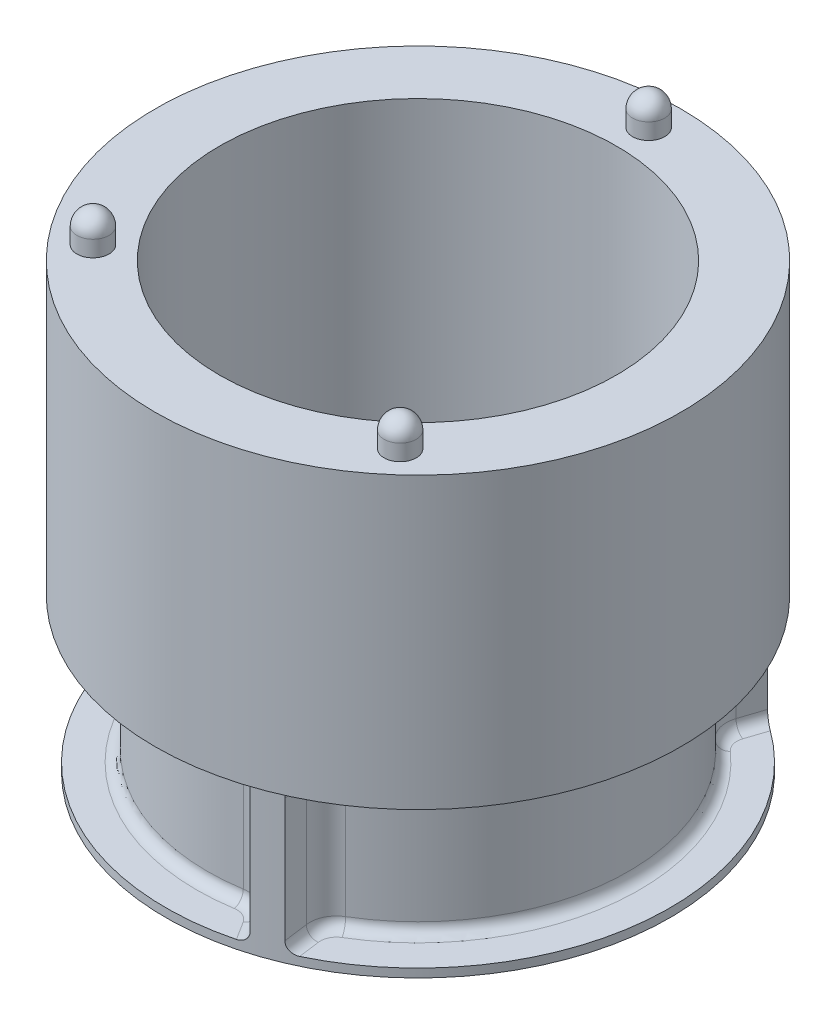
from build123d import *

# Parameters (mm, degrees)
SKETCH1_R            = 24.5
SKETCH1_R_2          = 18.5
BOSS_EXTRUDE1_DEPTH  = 27
SKETCH2_R            = 19.625
SKETCH2_R_2          = 18.125
BOSS_EXTRUDE2_DEPTH  = 13.5
SKETCH4_R            = 23.5
SKETCH4_R_2          = 18.125
BOSS_EXTRUDE3_DEPTH  = 0.8
SKETCH3_R            = 1.5
BOSS_EXTRUDE4_DEPTH  = 3
FILLET1_R            = 1.5
BOSS_EXTRUDE14_DEPTH = 13.5
FILLET3_R            = 2.5
FILLET4_R            = 1


with BuildPart() as part:
    # Sketch1 → Boss-Extrude1 (new body)
    with BuildSketch(Plane(origin=(0, 0, 0), x_dir=(1, 0, 0), z_dir=(0, 1, 0))):
        with Locations(Location((0, 0, 0), (0, 0, 270))):
            Circle(SKETCH1_R)
        with Locations(Location((0, 0, 0), (0, 0, 270))):
            Circle(SKETCH1_R_2, mode=Mode.SUBTRACT)
    extrude(amount=-BOSS_EXTRUDE1_DEPTH)

    # Sketch2 → Boss-Extrude2 (add)
    with BuildSketch(Plane.XZ.offset(27)):
        with Locations(Location((0, 0, 0), (0, 0, 90))):
            Circle(SKETCH2_R)
        with Locations(Location((0, 0, 0), (0, 0, 270))):
            Circle(SKETCH2_R_2, mode=Mode.SUBTRACT)
    extrude(amount=BOSS_EXTRUDE2_DEPTH)

    # Sketch4 → Boss-Extrude3 (add)
    with BuildSketch(Plane.XZ.offset(40.5)):
        with Locations(Location((0, 0, 0), (0, 0, 270))):
            Circle(SKETCH4_R)
        with Locations(Location((0, 0, 0), (0, 0, 270))):
            Circle(SKETCH4_R_2, mode=Mode.SUBTRACT)
    extrude(amount=BOSS_EXTRUDE3_DEPTH)

    # Sketch3 → Boss-Extrude4 (add)
    with BuildSketch(Plane(origin=(0, 0, 0), x_dir=(1, 0, 0), z_dir=(0, 1, 0))):
        with Locations(Location((0, 21.5, 0), (0, 0, 270))):
            Circle(SKETCH3_R)
        with Locations(Location((-16.426644714, -13.871815665, 0), (0, 0, 270))):
            Circle(SKETCH3_R)
        with Locations(Location((14.349874969, -16.010343168, 0), (0, 0, 270))):
            Circle(SKETCH3_R)
    extrude(amount=BOSS_EXTRUDE4_DEPTH)

    # Fillet1
    fillet1_edges = [part.edges().sort_by_distance(p)[0] for p in [
        (0, 3, -23),
        (-16.426644714, 3, 12.371815665),
        (14.349874969, 3, 14.510343168),
    ]]
    fillet(fillet1_edges, radius=FILLET1_R)

    # Sketch6 → Boss-Extrude14 (add)
    with BuildSketch(Plane.XZ.offset(27)):
        with BuildLine():
            Line((10.427001294, -21.060096012), (6.880284611, -17.172992857))
            ThreePointArc((6.880284611, -17.172992857), (9.221324303, -16.03799171), (11.379993428, -14.585806443))
            Line((11.379993428, -14.585806443), (13.025077505, -19.560096012))
            ThreePointArc((13.025077505, -19.560096012), (11.75, -20.351596989), (10.427001294, -21.060096012))
        make_face()
        with BuildLine():
            Line((9.20904846, 21.620440015), (8.507694451, 16.427694151))
            ThreePointArc((8.507694451, 16.427694151), (6.327372652, 17.384313485), (4.042246199, 18.052984398))
            Line((4.042246199, 18.052984398), (6.842810559, 22.481680179))
            ThreePointArc((6.842810559, 22.481680179), (8.037473368, 22.082776588), (9.20904846, 21.620440015))
        make_face()
    extrude(amount=BOSS_EXTRUDE14_DEPTH)

    # Fillet3
    fillet3_edges = [part.edges().sort_by_distance(p)[0] for p in [
        (8.667040078, -33.75, 17.607471178),
        (4.678526421, -33.75, 19.059171428),
        (11.753741984, -33.75, -15.715921048),
        (7.686830622, -33.75, -18.056944924),
    ]]
    fillet(fillet3_edges, radius=FILLET3_R)

    # Fillet4
    # the kernel refuses this fillet: 1 mm, written as the material it adds along each edge
    with BuildSketch(Plane(origin=(5.597678623, -27, 20.512680419), x_dir=(-0.845187772005224, 0, 0.5344694846788222), z_dir=(0.5344694846788222, 0, 0.845187772005224))) as fillet4_piece_1_section:
        with BuildLine():
            CenterArc((FILLET4_R, FILLET4_R), FILLET4_R, 180, 90)
            Line((0, FILLET4_R), (0, 0))
            Line((0, 0), (FILLET4_R, 0))
        make_face()
    fillet4_piece_1 = extrude(amount=4.829659544, mode=Mode.PRIVATE)
    fillet4_piece_1 = fillet4_piece_1 & Plane(origin=(0, -27.229900113, 0), x_dir=(0.29118342802716585, 0, 0.9566672416479768), z_dir=(0, 1, 0)) * Cylinder(23.5, 14, mode=Mode.PRIVATE)
    add(fillet4_piece_1)
    with BuildSketch(Plane(origin=(5.597678623, -40.5, 20.512680419), x_dir=(0, 1, 0), z_dir=(0.5344694846788222, 0, 0.845187772005224))) as fillet4_piece_2_section:
        with BuildLine():
            CenterArc((FILLET4_R, FILLET4_R), FILLET4_R, 180, 90)
            Line((0, FILLET4_R), (0, 0))
            Line((0, 0), (FILLET4_R, 0))
        make_face()
    fillet4_piece_2 = extrude(amount=4.829659544, mode=Mode.PRIVATE)
    fillet4_piece_2 = fillet4_piece_2 & Plane(origin=(0, -40.270099952, 0), x_dir=(0.29118342802716585, 0, 0.9566672416479768), z_dir=(0, 1, 0)) * Cylinder(23.5, 14, mode=Mode.PRIVATE)
    add(fillet4_piece_2)
    with BuildSketch(Plane(origin=(12.293956137, -27, -17.349382624), x_dir=(0.9494257570669186, 0, 0.31399161106295287), z_dir=(0.31399161106295287, 0, -0.9494257570669186))) as fillet4_piece_3_section:
        with BuildLine():
            CenterArc((FILLET4_R, FILLET4_R), FILLET4_R, 180, 90)
            Line((0, FILLET4_R), (0, 0))
            Line((0, 0), (FILLET4_R, 0))
        make_face()
    fillet4_piece_3 = extrude(amount=4.828474208, mode=Mode.PRIVATE)
    fillet4_piece_3 = fillet4_piece_3 & Plane(origin=(0, -27.229897282, 0), x_dir=(0.554258617244049, 0, -0.8323445111314876), z_dir=(0, 1, 0)) * Cylinder(23.5, 14, mode=Mode.PRIVATE)
    add(fillet4_piece_3)
    with BuildSketch(Plane(origin=(12.293956137, -40.5, -17.349382624), x_dir=(0, 1, 0), z_dir=(0.31399161106295287, 0, -0.9494257570669186))) as fillet4_piece_4_section:
        with BuildLine():
            CenterArc((FILLET4_R, FILLET4_R), FILLET4_R, 180, 90)
            Line((0, FILLET4_R), (0, 0))
            Line((0, 0), (FILLET4_R, 0))
        make_face()
    fillet4_piece_4 = extrude(amount=4.828474208, mode=Mode.PRIVATE)
    fillet4_piece_4 = fillet4_piece_4 & Plane(origin=(0, -40.270102709, 0), x_dir=(0.554258617244049, 0, -0.8323445111314876), z_dir=(0, 1, 0)) * Cylinder(23.5, 14, mode=Mode.PRIVATE)
    add(fillet4_piece_4)
    with BuildSketch(Plane(origin=(12.112058593, -40.5, -22.906872094), x_dir=(0, 1, 0), z_dir=(-0.6740229195535309, 0, 0.7387104330632771))) as fillet4_piece_5_section:
        with BuildLine():
            CenterArc((FILLET4_R, FILLET4_R), FILLET4_R, 180, 90)
            Line((0, FILLET4_R), (0, 0))
            Line((0, 0), (FILLET4_R, 0))
        make_face()
    fillet4_piece_5 = extrude(amount=4.870222046, mode=Mode.PRIVATE)
    fillet4_piece_5 = fillet4_piece_5 & Plane(origin=(0, -40.270007691, 0), x_dir=(0.554258617244049, 0, -0.8323445111314876), z_dir=(0, 1, 0)) * Cylinder(23.5, 14, mode=Mode.PRIVATE)
    add(fillet4_piece_5)
    with BuildSketch(Plane(origin=(12.112058593, -27, -22.906872094), x_dir=(-0.7387104330632771, 0, -0.6740229195535309), z_dir=(-0.6740229195535309, 0, 0.7387104330632771))) as fillet4_piece_6_section:
        with BuildLine():
            CenterArc((FILLET4_R, FILLET4_R), FILLET4_R, 180, 90)
            Line((0, FILLET4_R), (0, 0))
            Line((0, 0), (FILLET4_R, 0))
        make_face()
    fillet4_piece_6 = extrude(amount=4.870222046, mode=Mode.PRIVATE)
    fillet4_piece_6 = fillet4_piece_6 & Plane(origin=(0, -27.229992277, 0), x_dir=(0.554258617244049, 0, -0.8323445111314876), z_dir=(0, 1, 0)) * Cylinder(23.5, 14, mode=Mode.PRIVATE)
    add(fillet4_piece_6)
    with BuildSketch(Plane(origin=(0, -27, 0), x_dir=(0.31559960351651706, 0, -0.9488924545280235), z_dir=(0.9488924545280235, 0, 0.31559960351651706))) as fillet4_piece_7:
        with BuildLine():
            CenterArc((19.625 + FILLET4_R, -FILLET4_R), FILLET4_R, 90, 90)
            Line((19.625, -FILLET4_R), (19.625, 0))
            Line((19.625, 0), (19.625 + FILLET4_R, 0))
        make_face()
    revolve(axis=Axis((0, -27, 0), (0, 1, 0)), revolution_arc=207.458888938)
    with BuildSketch(Plane(origin=(9.543670582, -27, 24.097944412), x_dir=(0.9910017586438099, 0, -0.133848848948641), z_dir=(-0.133848848948641, 0, -0.9910017586438098))) as fillet4_piece_8_section:
        with BuildLine():
            CenterArc((FILLET4_R, FILLET4_R), FILLET4_R, 180, 90)
            Line((0, FILLET4_R), (0, 0))
            Line((0, 0), (FILLET4_R, 0))
        make_face()
    fillet4_piece_8 = extrude(amount=4.829659544, mode=Mode.PRIVATE)
    fillet4_piece_8 = fillet4_piece_8 & Plane(origin=(0, -27.229900043, 0), x_dir=(0.29118342802716585, 0, 0.9566672416479768), z_dir=(0, 1, 0)) * Cylinder(23.5, 14, mode=Mode.PRIVATE)
    add(fillet4_piece_8)
    with BuildSketch(Plane(origin=(0, -27, 0), x_dir=(0.6629387810190173, 0, -0.7486736088717295), z_dir=(-0.7486736088717295, 0, -0.6629387810190173))) as fillet4_piece_9:
        with BuildLine():
            CenterArc((19.625 + FILLET4_R, FILLET4_R), FILLET4_R, 180, 90)
            Line((19.625, FILLET4_R), (19.625, 0))
            Line((19.625, 0), (19.625 + FILLET4_R, 0))
        make_face()
    revolve(axis=Axis((0, -27, 0), (0, -1, 0)), revolution_arc=107.537485904)
    with BuildSketch(Plane(origin=(3.484709193, -27, 21.848854131), x_dir=(-0.15750098046494554, 0, -0.9875188307837884), z_dir=(-0.9875188307837884, 0, 0.15750098046494554))) as fillet4_piece_10:
        with BuildLine():
            CenterArc((2.5 - FILLET4_R, FILLET4_R), FILLET4_R, 270, 90)
            Line((2.5, FILLET4_R), (2.5, 0))
            Line((2.5, 0), (2.5 - FILLET4_R, 0))
        make_face()
    revolve(axis=Axis((3.484709193, -27, 21.848854131), (0, -1, 0)), revolution_arc=66.753933518)
    with BuildSketch(Plane(origin=(11.374730608, -27, 18.977121188), x_dir=(-0.514112117888976, 0, -0.8577229915536319), z_dir=(0.8577229915536319, 0, -0.514112117888976))) as fillet4_piece_11:
        with BuildLine():
            CenterArc((2.5 - FILLET4_R, -FILLET4_R), FILLET4_R, 0, 90)
            Line((2.5, -FILLET4_R), (2.5, 0))
            Line((2.5, 0), (2.5 - FILLET4_R, 0))
        make_face()
    revolve(axis=Axis((11.374730608, -27, 18.977121188), (0, 1, 0)), revolution_arc=66.753933518)
    with BuildSketch(Plane(origin=(14.66752053, -27, -16.564403596), x_dir=(-0.6629387810190174, 0, 0.7486736088717294), z_dir=(0.7486736088717294, 0, 0.6629387810190174))) as fillet4_piece_12:
        with BuildLine():
            CenterArc((2.5 - FILLET4_R, FILLET4_R), FILLET4_R, 270, 90)
            Line((2.5, FILLET4_R), (2.5, 0))
            Line((2.5, 0), (2.5 - FILLET4_R, 0))
        make_face()
    revolve(axis=Axis((14.66752053, -27, -16.564403596), (0, -1, 0)), revolution_arc=66.775561076)
    with BuildSketch(Plane(origin=(6.982641228, -27, -20.994245556), x_dir=(0.7387104330632772, 0, 0.6740229195535309), z_dir=(0.6740229195535309, 0, -0.7387104330632772))) as fillet4_piece_13:
        with BuildLine():
            CenterArc((2.5 - FILLET4_R, FILLET4_R), FILLET4_R, 270, 90)
            Line((2.5, FILLET4_R), (2.5, 0))
            Line((2.5, 0), (2.5 - FILLET4_R, 0))
        make_face()
    revolve(axis=Axis((6.982641228, -27, -20.994245556), (0, -1, 0)), revolution_arc=66.01869491)
    with BuildSketch(Plane(origin=(0, -40.5, 0), x_dir=(0.31559960351651706, 0, -0.9488924545280235), z_dir=(0.9488924545280235, 0, 0.31559960351651706))) as fillet4_piece_14:
        with BuildLine():
            CenterArc((19.625 + FILLET4_R, FILLET4_R), FILLET4_R, 180, 90)
            Line((19.625 + FILLET4_R, 0), (19.625, 0))
            Line((19.625, 0), (19.625, FILLET4_R))
        make_face()
    revolve(axis=Axis((0, -40.5, 0), (0, 1, 0)), revolution_arc=207.458888938)
    with BuildSketch(Plane(origin=(3.484709193, -40.5, 21.848854131), x_dir=(-0.15750098046494554, 0, -0.9875188307837884), z_dir=(-0.9875188307837884, 0, 0.15750098046494554))) as fillet4_piece_15:
        with BuildLine():
            CenterArc((2.5 - FILLET4_R, -FILLET4_R), FILLET4_R, 0, 90)
            Line((2.5 - FILLET4_R, 0), (2.5, 0))
            Line((2.5, 0), (2.5, -FILLET4_R))
        make_face()
    revolve(axis=Axis((3.484709193, -40.5, 21.848854131), (0, -1, 0)), revolution_arc=66.753933518)
    with BuildSketch(Plane(origin=(6.982641228, -40.5, -20.994245556), x_dir=(0.7387104330632772, 0, 0.6740229195535309), z_dir=(0.6740229195535309, 0, -0.7387104330632772))) as fillet4_piece_16:
        with BuildLine():
            CenterArc((2.5 - FILLET4_R, -FILLET4_R), FILLET4_R, 0, 90)
            Line((2.5 - FILLET4_R, 0), (2.5, 0))
            Line((2.5, 0), (2.5, -FILLET4_R))
        make_face()
    revolve(axis=Axis((6.982641228, -40.5, -20.994245556), (0, -1, 0)), revolution_arc=66.01869491)
    with BuildSketch(Plane(origin=(0, -40.5, 0), x_dir=(0.6629387810190173, 0, -0.7486736088717295), z_dir=(-0.7486736088717295, 0, -0.6629387810190173))) as fillet4_piece_17:
        with BuildLine():
            CenterArc((19.625 + FILLET4_R, -FILLET4_R), FILLET4_R, 90, 90)
            Line((19.625 + FILLET4_R, 0), (19.625, 0))
            Line((19.625, 0), (19.625, -FILLET4_R))
        make_face()
    revolve(axis=Axis((0, -40.5, 0), (0, -1, 0)), revolution_arc=107.537485904)
    with BuildSketch(Plane(origin=(9.543670582, -40.5, 24.097944412), x_dir=(0, 1, 0), z_dir=(-0.133848848948641, 0, -0.9910017586438098))) as fillet4_piece_18_section:
        with BuildLine():
            CenterArc((FILLET4_R, FILLET4_R), FILLET4_R, 180, 90)
            Line((0, FILLET4_R), (0, 0))
            Line((0, 0), (FILLET4_R, 0))
        make_face()
    fillet4_piece_18 = extrude(amount=4.829659544, mode=Mode.PRIVATE)
    fillet4_piece_18 = fillet4_piece_18 & Plane(origin=(0, -40.270099922, 0), x_dir=(0.29118342802716585, 0, 0.9566672416479768), z_dir=(0, 1, 0)) * Cylinder(23.5, 14, mode=Mode.PRIVATE)
    add(fillet4_piece_18)
    with BuildSketch(Plane(origin=(11.374730608, -40.5, 18.977121188), x_dir=(-0.514112117888976, 0, -0.8577229915536319), z_dir=(0.8577229915536319, 0, -0.514112117888976))) as fillet4_piece_19:
        with BuildLine():
            CenterArc((2.5 - FILLET4_R, FILLET4_R), FILLET4_R, 270, 90)
            Line((2.5 - FILLET4_R, 0), (2.5, 0))
            Line((2.5, 0), (2.5, FILLET4_R))
        make_face()
    revolve(axis=Axis((11.374730608, -40.5, 18.977121188), (0, 1, 0)), revolution_arc=66.753933518)
    with BuildSketch(Plane(origin=(14.66752053, -40.5, -16.564403596), x_dir=(-0.6629387810190174, 0, 0.7486736088717294), z_dir=(0.7486736088717294, 0, 0.6629387810190174))) as fillet4_piece_20:
        with BuildLine():
            CenterArc((2.5 - FILLET4_R, -FILLET4_R), FILLET4_R, 0, 90)
            Line((2.5 - FILLET4_R, 0), (2.5, 0))
            Line((2.5, 0), (2.5, -FILLET4_R))
        make_face()
    revolve(axis=Axis((14.66752053, -40.5, -16.564403596), (0, -1, 0)), revolution_arc=66.775561076)


solid = part.part
